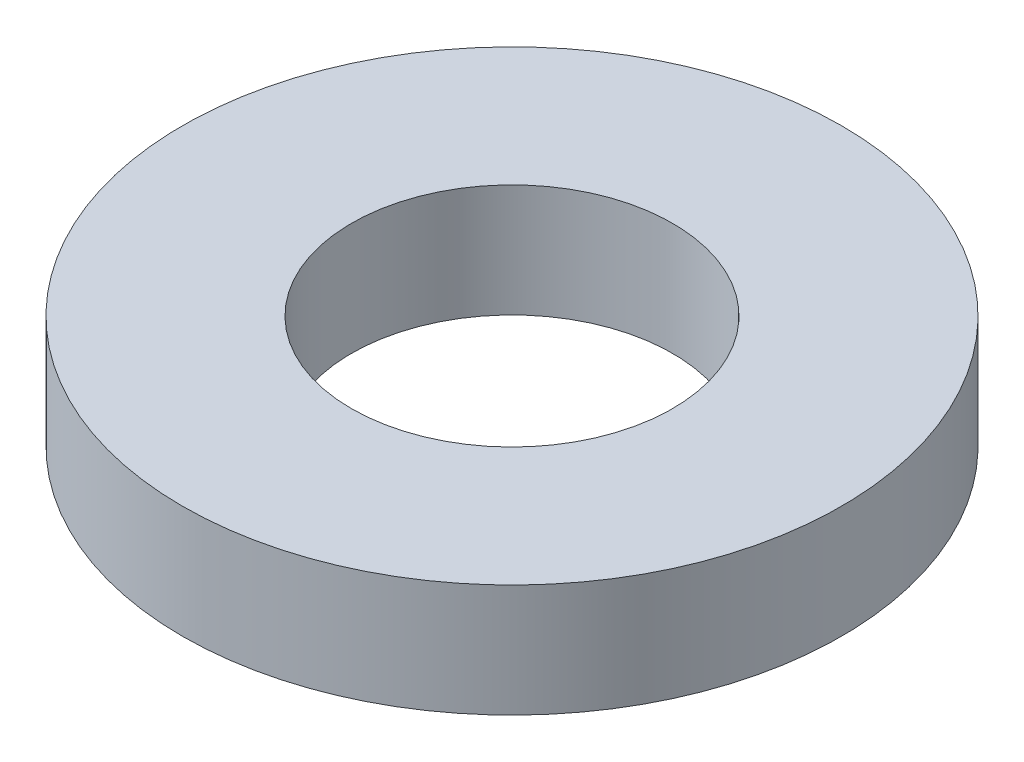
from build123d import *

# Parameters (mm, degrees)
SKETCH1_R           = 5.85
SKETCH1_R_2         = 2.85
BOSS_EXTRUDE1_DEPTH = 2


with BuildPart() as part:
    # Sketch1 → Boss-Extrude1 (new body)
    with BuildSketch(Plane(origin=(0, 0, 0), x_dir=(1, 0, 0), z_dir=(0, 1, 0))):
        Circle(SKETCH1_R)
        Circle(SKETCH1_R_2, mode=Mode.SUBTRACT)
    extrude(amount=BOSS_EXTRUDE1_DEPTH)


solid = part.part
